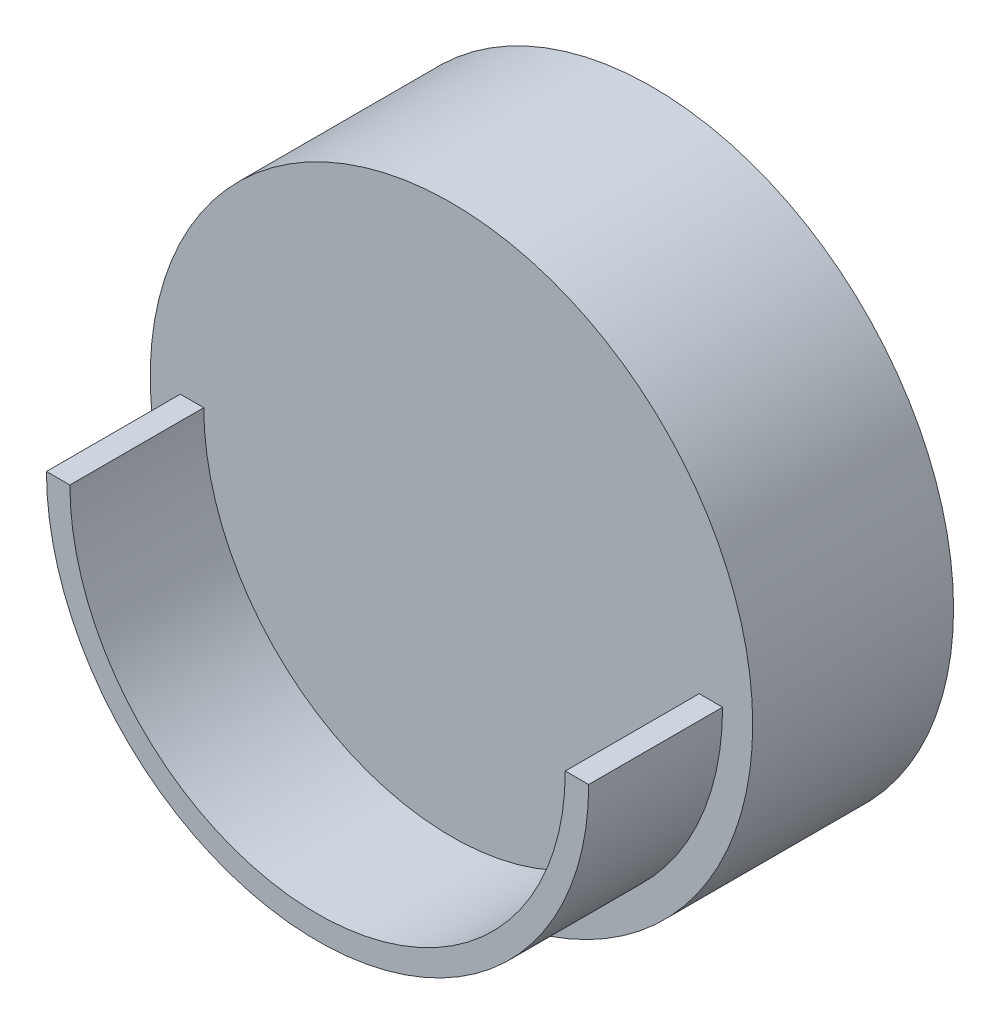
from build123d import *

# Parameters (mm, degrees)
SKETCH1_R               = 22.5
BOSS_EXTRUDE1_DEPTH     = 15
SKETCH2_R               = 20.25
SKETCH2_R_2             = 18.5
BOSS_EXTRUDE2_DEPTH     = 10
CUT_EXTRUDE1_DEPTH      = 41.466035141
CUT_EXTRUDE1_DEPTH_BACK = 41.466035141
SKETCH4_W               = 10
SKETCH4_H               = 24.752073401


with BuildPart() as part:
    # Sketch1 → Boss-Extrude1 (new body)
    with BuildSketch(Plane.XY):
        Circle(SKETCH1_R)
    extrude(amount=BOSS_EXTRUDE1_DEPTH)

    # Sketch2 → Boss-Extrude2 (add)
    with BuildSketch(Plane.XY.offset(15)):
        Circle(SKETCH2_R)
        Circle(SKETCH2_R_2, mode=Mode.SUBTRACT)
    extrude(amount=BOSS_EXTRUDE2_DEPTH)

    # Sketch4 → Cut-Extrude1 (cut, two sides: drawn at the far end of the back side and taken through both)
    with BuildSketch(Plane(origin=(0, 0, 0), x_dir=(0, 0, -1), z_dir=(1, 0, 0)).offset(-CUT_EXTRUDE1_DEPTH_BACK)):
        with Locations((-20, 12.376036701)):
            Rectangle(SKETCH4_W, SKETCH4_H)
    extrude(amount=CUT_EXTRUDE1_DEPTH + CUT_EXTRUDE1_DEPTH_BACK, mode=Mode.SUBTRACT)


solid = part.part
